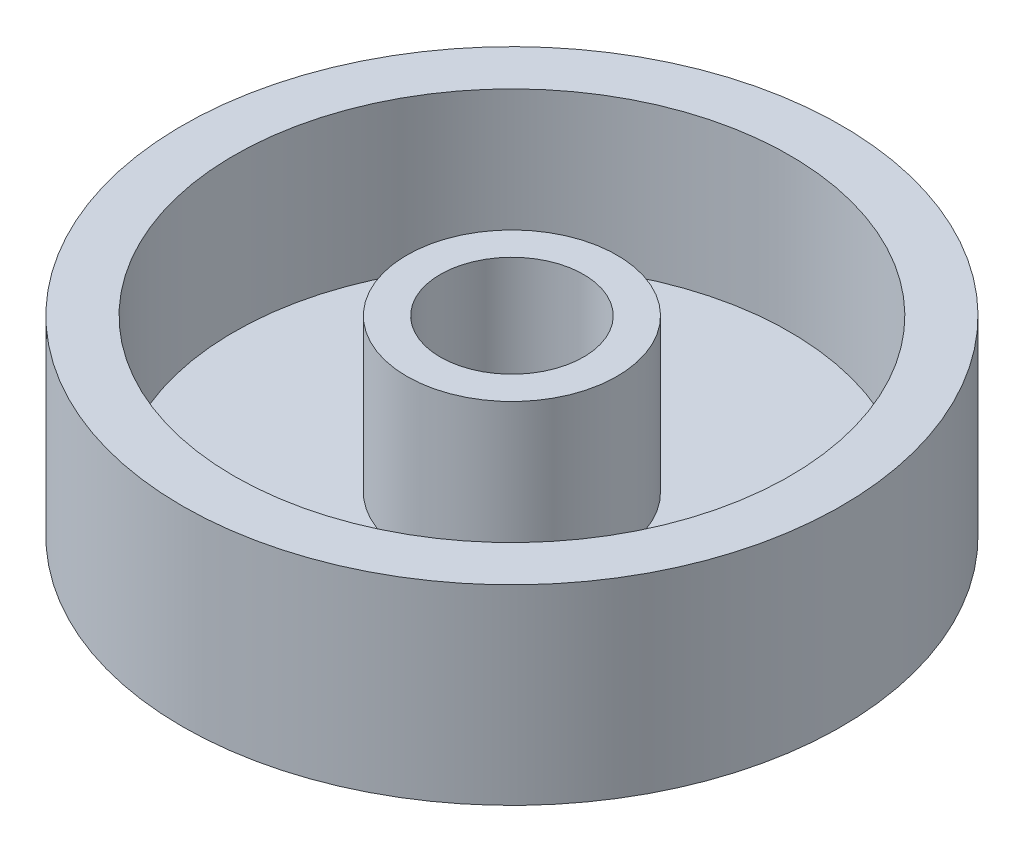
from build123d import *

# Parameters (mm, degrees)
SKETCH_1_R          = 6.9
EXTRUDE_1_DEPTH     = 4
SKETCH_2_R          = 5.817135152
SKETCH_2_R_2        = 2.2
CUT_EXTRUDE_2_DEPTH = 3.2
SKETCH_3_R          = 1.5
CUT_EXTRUDE_3_DEPTH = 11.546089323


with BuildPart() as part:
    # Эскиз1 → Вытянуть1 (new body)
    with BuildSketch(Plane(origin=(0, 0, 0), x_dir=(1, 0, 0), z_dir=(0, 1, 0))):
        Circle(SKETCH_1_R)
    extrude(amount=EXTRUDE_1_DEPTH)

    # Эскиз2 → Вытянуть2 (cut)
    with BuildSketch(Plane(origin=(0, 4, 0), x_dir=(1, 0, 0), z_dir=(0, 1, 0))):
        Circle(SKETCH_2_R)
        Circle(SKETCH_2_R_2, mode=Mode.SUBTRACT)
    extrude(amount=-CUT_EXTRUDE_2_DEPTH, mode=Mode.SUBTRACT)

    # Эскиз3 → Вытянуть3 (cut, through all)
    with BuildSketch(Plane(origin=(0, 4, 0), x_dir=(1, 0, 0), z_dir=(0, 1, 0))):
        Circle(SKETCH_3_R)
    extrude(amount=-CUT_EXTRUDE_3_DEPTH, mode=Mode.SUBTRACT)


solid = part.part
